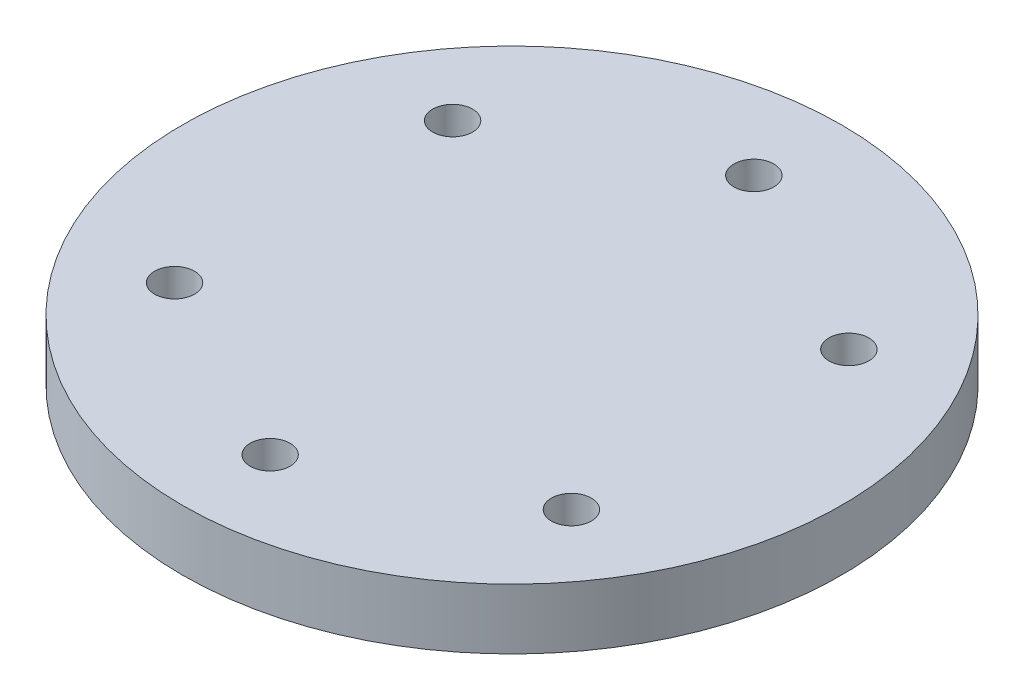
from build123d import *

# Parameters (mm, degrees)
SKETCH1_R           = 27.25
BOSS_EXTRUDE1_DEPTH = 5
SKETCH2_R           = 1.65
CUT_EXTRUDE1_DEPTH  = 10


with BuildPart() as part:
    # Sketch1 → Boss-Extrude1 (new body)
    with BuildSketch(Plane(origin=(0, 0, 0), x_dir=(1, 0, 0), z_dir=(0, 1, 0))):
        Circle(SKETCH1_R)
    extrude(amount=BOSS_EXTRUDE1_DEPTH)

    # Sketch2 → Cut-Extrude1 (cut)
    with BuildSketch(Plane(origin=(0, 5, 0), x_dir=(1, 0, 0), z_dir=(0, 1, 0))):
        with Locations((0, 20)):
            Circle(SKETCH2_R)
        with Locations((-16.383040886, 11.471528727)):
            Circle(SKETCH2_R)
        with Locations((16.383040886, 11.471528727)):
            Circle(SKETCH2_R)
        with Locations((16.383040886, -11.471528727)):
            Circle(SKETCH2_R)
        with Locations((0, -20)):
            Circle(SKETCH2_R)
        with Locations((-16.27093552, -11.629989565)):
            Circle(SKETCH2_R)
    extrude(amount=-CUT_EXTRUDE1_DEPTH, mode=Mode.SUBTRACT)


solid = part.part
